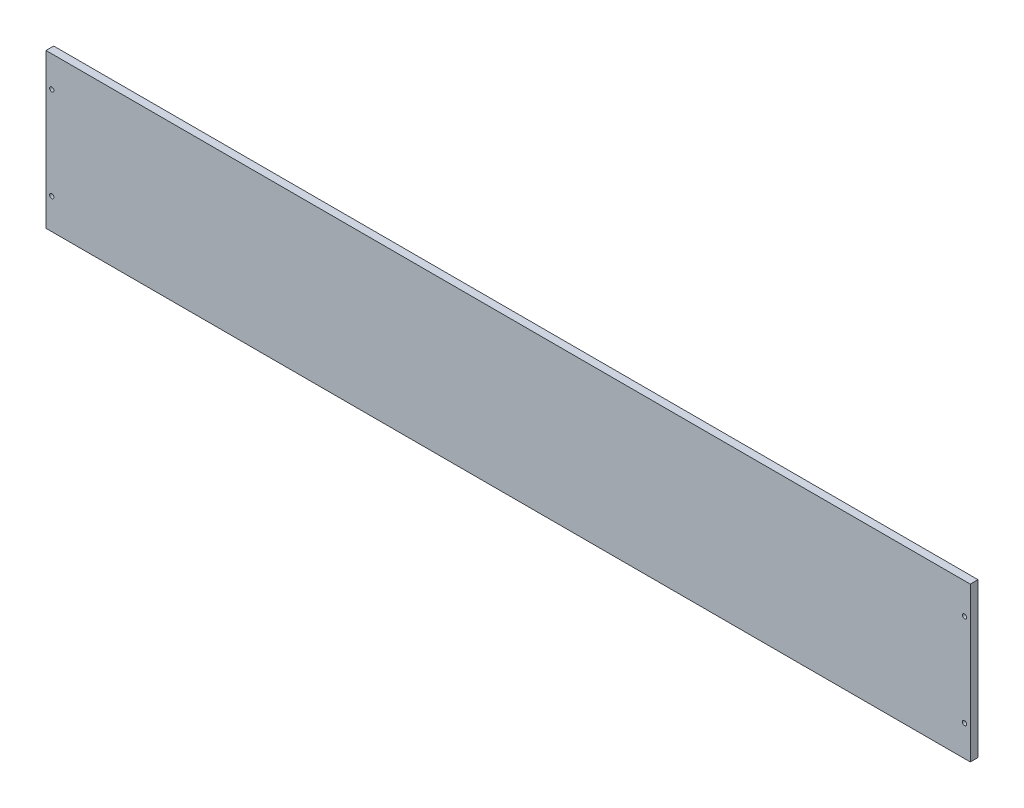
from build123d import *

# Parameters (mm, degrees)
ESQUISSE1_W             = 1200
ESQUISSE1_H             = 200
BOSS_EXTRU_1_DEPTH      = 10
ESQUISSE2_R             = 2.75
ENL_V_MAT_EXTRU_1_DEPTH = 10
CHANFREIN1_SIZE         = 2.5


with BuildPart() as part:
    # Esquisse1 → Boss.-Extru.1 (new body)
    with BuildSketch(Plane.XY):
        with Locations((600, -100)):
            Rectangle(ESQUISSE1_W, ESQUISSE1_H)
    extrude(amount=BOSS_EXTRU_1_DEPTH)

    # Esquisse2 → Enlèv. mat.-Extru.1 (cut)
    with BuildSketch(Plane.XY.offset(10)):
        with Locations((7.5, -40)):
            Circle(ESQUISSE2_R)
        with Locations((7.5, -160)):
            Circle(ESQUISSE2_R)
        with Locations((1192.5, -40)):
            Circle(ESQUISSE2_R)
        with Locations((1192.5, -160)):
            Circle(ESQUISSE2_R)
    extrude(amount=-ENL_V_MAT_EXTRU_1_DEPTH, mode=Mode.SUBTRACT)

    # Chanfrein1
    chanfrein1_edges = [part.edges().sort_by_distance(p)[0] for p in [
        (4.75, -160, 0),
        (4.75, -40, 0),
        (1189.75, -40, 0),
        (1189.75, -160, 0),
    ]]
    chamfer(chanfrein1_edges, length=CHANFREIN1_SIZE)


solid = part.part
